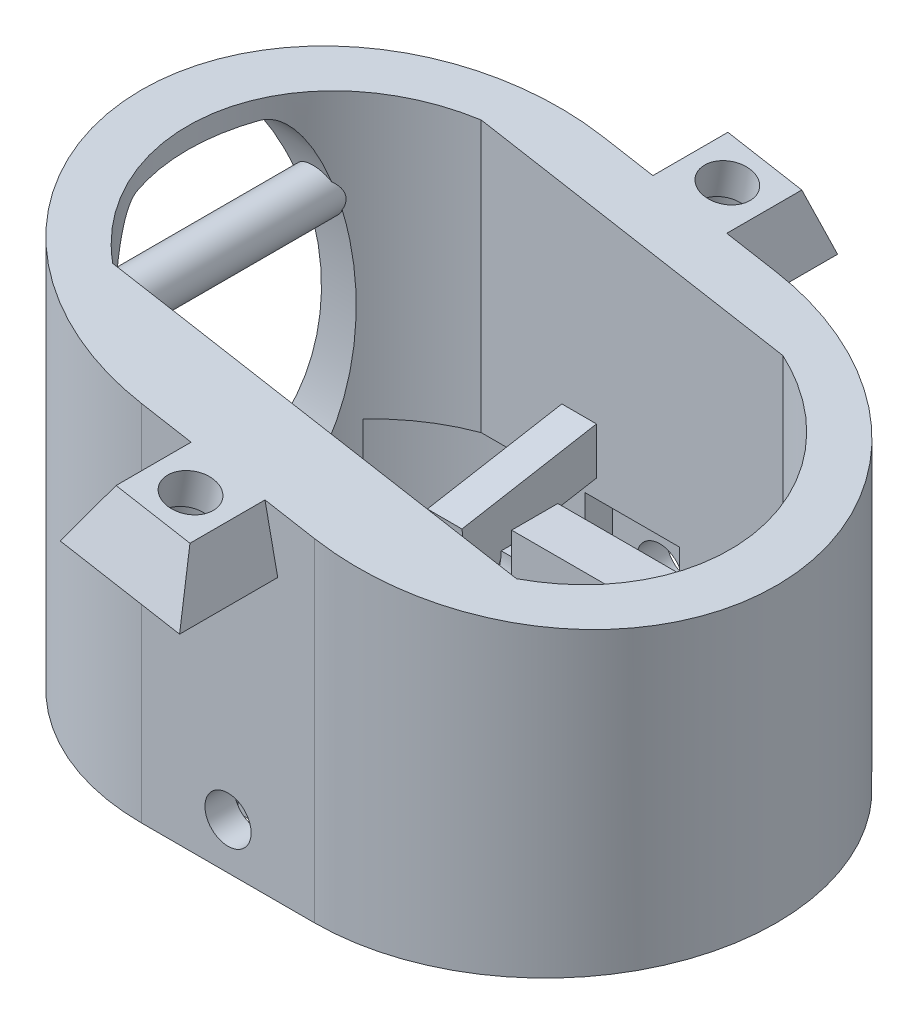
from build123d import *
from build123d.topology import SkipClean

# Parameters (mm, degrees)
BOSS_EXTRUDE1_DEPTH      = 10
BOSS_EXTRUDE1_DEPTH_BACK = 10
SKETCH1_W                = 8.2
SKETCH1_H                = 2.4
SKETCH1_R                = 1.1
BOSS_EXTRUDE2_START      = -11
BOSS_EXTRUDE2_DEPTH      = 11
CUT_EXTRUDE1_DEPTH       = 35
CUT_EXTRUDE1_DEPTH_BACK  = 25
SKETCH4_R                = 2
BOSS_EXTRUDE3_DEPTH      = 15
CUT_EXTRUDE2_DEPTH       = 20
CUT_EXTRUDE2_DEPTH_BACK  = 20
CUT_EXTRUDE3_DEPTH       = 20
CUT_EXTRUDE3_DEPTH_BACK  = 20
CUT_EXTRUDE4_DEPTH       = 40
BOSS_EXTRUDE4_DEPTH      = 10.2
BOSS_EXTRUDE4_DEPTH_BACK = 10.2
SKETCH9_R                = 2
BOSS_EXTRUDE6_DEPTH      = 2
BOSS_EXTRUDE6_DEPTH_BACK = 2
BOSS_EXTRUDE7_DEPTH      = 6.9
REVOLVE1_ANGLE           = 45
REVOLVE1_OTHER_WAY_ANGLE = 45
SKETCH15_W               = 3
SKETCH15_H               = 4.1
REVOLVE2_ANGLE           = 100
REVOLVE2_OTHER_WAY_ANGLE = 100
SKETCH16_W               = 3
SKETCH16_H               = 15
BOSS_EXTRUDE8_DEPTH      = 4
SKETCH17_W               = 3
SKETCH17_H               = 11.117878502
BOSS_EXTRUDE9_DEPTH      = 4
SKETCH20_R               = 2
CUT_EXTRUDE5_DEPTH       = 5
SKETCH22_R               = 3.25
CUT_EXTRUDE6_DEPTH       = 2


with BuildPart() as part:
    # Sketch1 → Boss-Extrude1 (new, two sides: drawn at the far end of the back side and taken through both)
    with BuildSketch(Plane(origin=(0, 0, 0), x_dir=(1, 0, 0), z_dir=(0, 1, 0)).offset(-BOSS_EXTRUDE1_DEPTH_BACK)):
        with BuildLine():
            Line((7.5, 20), (-7.5, 20))
            ThreePointArc((-7.5, 20), (-27.5, 0), (-7.5, -20))
            Line((-7.5, -20), (7.5, -20))
            ThreePointArc((7.5, -20), (27.5, 0), (7.5, 20))
        make_face()
        with Locations((0, -16.25)):
            Rectangle(SKETCH1_W, SKETCH1_H, mode=Mode.SUBTRACT)
        with Locations((22.466629547, -10)):
            Circle(SKETCH1_R, mode=Mode.SUBTRACT)
        with BuildLine():
            ThreePointArc((13.067764363, 15), (23.297278294, 2.538897101), (17.487492178, -12.5))
            Line((17.487492178, -12.5), (-15.609253973, -12.5))
            ThreePointArc((-15.609253973, -12.5), (-11.728474902, -14.287407043), (-7.5, -14.9))
            Line((-7.5, -14.9), (-7.5, -17.1))
            ThreePointArc((-7.5, -17.1), (-14.318609079, -15.681727272), (-20.006148298, -11.662171957))
            Line((-20.006148298, -11.662171957), (-19.201659226, -10.911973761))
            ThreePointArc((-19.201659226, -10.911973761), (-23.5, 0), (-19.201659226, 10.911973761))
            Line((-19.201659226, 10.911973761), (-20.006148298, 11.662171957))
            ThreePointArc((-20.006148298, 11.662171957), (-14.318609079, 15.681727272), (-7.5, 17.1))
            Line((-7.5, 17.1), (-7.5, 15))
            Line((-7.5, 15), (-4.1, 15))
            Line((-4.1, 15), (-4.1, 17.4))
            Line((-4.1, 17.4), (4.1, 17.4))
            Line((4.1, 17.4), (4.1, 15))
            Line((4.1, 15), (13.067764363, 15))
        make_face(mode=Mode.SUBTRACT)
        with Locations((22.466629547, 10)):
            Circle(SKETCH1_R, mode=Mode.SUBTRACT)
    extrude(amount=BOSS_EXTRUDE1_DEPTH + BOSS_EXTRUDE1_DEPTH_BACK)

    # Sketch3 → Boss-Extrude2 (add)
    with SkipClean():  # the faces are left unmerged after this step: merging them gives an invalid solid
        with BuildSketch(Plane(origin=(0, 10, 0), x_dir=(1, 0, 0), z_dir=(0, 1, 0)).offset(BOSS_EXTRUDE2_START)):
            with BuildLine():
                Line((-7.5, 20), (7.5, 20))
                ThreePointArc((7.5, 20), (27.5, 0), (7.5, -20))
                Line((7.5, -20), (-7.5, -20))
                ThreePointArc((-7.5, -20), (-27.5, 0), (-7.5, 20))
            make_face()
            with BuildLine():
                Line((13.067764363, 15), (-13.067764363, 15))
                ThreePointArc((-13.067764363, 15), (-23.297278294, 2.538897101), (-17.487492178, -12.5))
                Line((-17.487492178, -12.5), (17.487492178, -12.5))
                ThreePointArc((17.487492178, -12.5), (23.297278294, 2.538897101), (13.067764363, 15))
            make_face(mode=Mode.SUBTRACT)
        extrude(amount=BOSS_EXTRUDE2_DEPTH)

    # Sketch4 → Cut-Extrude1 (cut, two sides: drawn at the far end of the back side and taken through both)
    with SkipClean():  # the faces are left unmerged after this step: merging them gives an invalid solid
        with BuildSketch(Plane.XY.offset(-CUT_EXTRUDE1_DEPTH_BACK)):
            with Locations((0, -6)):
                Circle(SKETCH4_R)
        extrude(amount=CUT_EXTRUDE1_DEPTH + CUT_EXTRUDE1_DEPTH_BACK, mode=Mode.SUBTRACT)

    # Sketch5 → Boss-Extrude3 (add)
    with SkipClean():  # the faces are left unmerged after this step: merging them gives an invalid solid
        with BuildSketch(Plane(origin=(0, 10, 0), x_dir=(1, 0, 0), z_dir=(0, 1, 0))):
            with BuildLine():
                Line((-7.5, 20), (7.5, 20))
                ThreePointArc((7.5, 20), (27.5, 0), (7.5, -20))
                Line((7.5, -20), (-7.5, -20))
                ThreePointArc((-7.5, -20), (-27.5, 0), (-7.5, 20))
            make_face()
            with BuildLine():
                Line((-13.067764363, 15), (13.067764363, 15))
                ThreePointArc((13.067764363, 15), (23.297278294, 2.538897101), (17.487492178, -12.5))
                Line((17.487492178, -12.5), (-17.487492178, -12.5))
                ThreePointArc((-17.487492178, -12.5), (-23.297278294, 2.538897101), (-13.067764363, 15))
            make_face(mode=Mode.SUBTRACT)
        extrude(amount=BOSS_EXTRUDE3_DEPTH)
    add(part.part.scale(1), mode=Mode.REPLACE)  # the faces are merged on a copy

    # Sketch6 → Cut-Extrude2 (cut, two sides: drawn at the far end of the back side and taken through both)
    with BuildSketch(Plane.XY.offset(-CUT_EXTRUDE2_DEPTH_BACK)):
        Polygon((-27.5, 25), (27.5, 15.302016061), (27.5, 25), align=None)
    extrude(amount=CUT_EXTRUDE2_DEPTH + CUT_EXTRUDE2_DEPTH_BACK, mode=Mode.SUBTRACT)

    # Sketch7 → Cut-Extrude3 (cut, two sides: drawn at the far end of the back side and taken through both)
    with BuildSketch(Plane.XY.offset(-CUT_EXTRUDE3_DEPTH_BACK)):
        with BuildLine():
            Line((-27.5, 25), (-27.5, -10))
            ThreePointArc((-27.5, -10), (-27.317925824, -8.699980377), (-26.785714286, -7.5))
            ThreePointArc((-26.785714286, -7.5), (-22.5, 7.5), (-26.785714286, 22.5))
            ThreePointArc((-26.785714286, 22.5), (-27.317925824, 23.699980377), (-27.5, 25))
        make_face()
    extrude(amount=CUT_EXTRUDE3_DEPTH + CUT_EXTRUDE3_DEPTH_BACK, mode=Mode.SUBTRACT)

    # Sketch8 → Cut-Extrude4 (cut)
    with BuildSketch(Plane(origin=(0, 0, 0), x_dir=(0, 0, -1), z_dir=(1, 0, 0))):
        with BuildLine():
            Line((5.297284634, 22.5), (-5.297284634, 22.5))
            add(Edge.make_bspline(
                [(-5.297284634, 22.5), (-10.594569267, 22.5), (-10.594569267, 7.5), (-10.594569267, -7.5), (-5.297284634, -7.5)],
                knots=[0, 0, 0, 1.570796327, 1.570796327, 3.141592654, 3.141592654, 3.141592654], degree=2, weights=[1, 0.707106781, 1, 0.707106781, 1]))
            Line((-5.297284634, -7.5), (5.297284634, -7.5))
            add(Edge.make_bspline(
                [(5.297284634, -7.5), (10.594569267, -7.5), (10.594569267, 7.5), (10.594569267, 22.5), (5.297284634, 22.5)],
                knots=[3.141592654, 3.141592654, 3.141592654, 4.71238898, 4.71238898, 6.283185307, 6.283185307, 6.283185307], degree=2, weights=[1, 0.707106781, 1, 0.707106781, 1]))
        make_face()
    extrude(amount=-CUT_EXTRUDE4_DEPTH, mode=Mode.SUBTRACT)

    # Sketch9 → Boss-Extrude4 (add, two sides: drawn at the far end of the back side and taken through both)
    with BuildSketch(Plane.XY.offset(-BOSS_EXTRUDE4_DEPTH_BACK)):
        with Locations((-21.892584487, 15.541905691)):
            Circle(SKETCH9_R)
    extrude(amount=BOSS_EXTRUDE4_DEPTH + BOSS_EXTRUDE4_DEPTH_BACK)

    # Sketch11 → Boss-Extrude6 (add, two sides: drawn at the far end of the back side and taken through both)
    with BuildSketch(Plane.XY.offset(-BOSS_EXTRUDE6_DEPTH_BACK)):
        Polygon((9.566629547, 7.5), (23.566629547, 7.5), (23.566629547, 10), (6.566629547, 10), (6.566629547, -5), (23.566629547, -5), (23.566629547, -2.5), (9.566629547, -2.5), align=None)
    extrude(amount=BOSS_EXTRUDE6_DEPTH + BOSS_EXTRUDE6_DEPTH_BACK)

    # Sketch12 → Boss-Extrude7 (add)
    with BuildSketch(Plane.ZY.offset(-6.566629547)):
        with BuildLine():
            Line((-6, 2), (-4, 2))
            ThreePointArc((-4, 2), (0, -2), (4, 2))
            Line((4, 2), (6, 2))
            ThreePointArc((6, 2), (0, -4), (-6, 2))
        make_face()
    extrude(amount=BOSS_EXTRUDE7_DEPTH)

    # Sketch14 → Revolve1 (revolve)
    with BuildSketch(Plane.XY):
        Polygon((-0.533370453, -3), (-3.083370453, -3), (-3.083370453, -5.5), (-0.333370453, -5.5), (1.166629547, -4), (-0.333370453, -4), (-0.333370453, -2.8), align=None)
    revolve(axis=Axis((0.328528027, 2, 0), (-1, 0, 0)), revolution_arc=REVOLVE1_ANGLE)

    # Sketch14 → Revolve1 other way (revolve)
    with BuildSketch(Plane.XY):
        Polygon((-0.533370453, -3), (-3.083370453, -3), (-3.083370453, -5.5), (-0.333370453, -5.5), (1.166629547, -4), (-0.333370453, -4), (-0.333370453, -2.8), align=None)
    revolve(axis=Axis((0.328528027, 2, 0), (1, 0, 0)), revolution_arc=REVOLVE1_OTHER_WAY_ANGLE)

    # Sketch15 → Revolve2 (revolve)
    with BuildSketch(Plane.XY):
        with Locations((-4.583370453, -3.45)):
            Rectangle(SKETCH15_W, SKETCH15_H)
    revolve(axis=Axis((-3.715978021, 2, 0), (-1, 0, 0)), revolution_arc=REVOLVE2_ANGLE)

    # Sketch15 → Revolve2 other way (revolve)
    with BuildSketch(Plane.XY):
        with Locations((-4.583370453, -3.45)):
            Rectangle(SKETCH15_W, SKETCH15_H)
    revolve(axis=Axis((-3.715978021, 2, 0), (1, 0, 0)), revolution_arc=REVOLVE2_OTHER_WAY_ANGLE)

    # Sketch16 → Boss-Extrude8 (add)
    with BuildSketch(Plane(origin=(0, 1.939692621, 0.342020143), x_dir=(1, 0, 0), z_dir=(0, 0.9848077530122075, 0.17364817766693405))):
        with Locations((-4.583370453, 11.247296355)):
            Rectangle(SKETCH16_W, SKETCH16_H)
    extrude(amount=-BOSS_EXTRUDE8_DEPTH)

    # Sketch17 → Boss-Extrude9 (add)
    with BuildSketch(Plane(origin=(0, 1.939692621, -0.342020143), x_dir=(1, 0, 0), z_dir=(0, 0.9848077530122075, -0.17364817766693408))):
        with Locations((-4.583370453, -9.306235606)):
            Rectangle(SKETCH17_W, SKETCH17_H)
    extrude(amount=-BOSS_EXTRUDE9_DEPTH)

    # Sketch18 → Loft2 section 0
    with BuildSketch(Plane(origin=(3.446025327, 19.543380789, 0), x_dir=(0.9848077530122092, -0.17364817766692342, 0), z_dir=(0.17364817766692342, 0.9848077530122092, 0))):
        with BuildLine():
            Line((-6.749185823, 20), (-0.249185823, 20))
            Line((-0.249185823, 20), (-0.249185823, 26.5))
            Line((-0.249185823, 26.5), (-6.749185823, 26.5))
            Line((-6.749185823, 26.5), (-6.749185823, 20))
        make_face()
    # Sketch19 → Loft2 section 1
    with BuildSketch(Plane(origin=(2.577784439, 14.619342024, 0), x_dir=(-0.9848077530122092, 0.17364817766692342, 0), z_dir=(0.17364817766692342, 0.9848077530122092, 0))):
        with BuildLine():
            Line((8.749185823, -20), (-1.750814177, -20))
            Line((-1.750814177, -20), (-1.750814177, -28.5))
            Line((-1.750814177, -28.5), (8.749185823, -28.5))
            Line((8.749185823, -28.5), (8.749185823, -20))
        make_face()
    loft2 = loft()

    # Sketch20 → Cut-Extrude5 (cut)
    with BuildSketch(Plane(origin=(3.446025327, 19.543380789, 0), x_dir=(0.9848077530122092, -0.17364817766692342, 0), z_dir=(0.17364817766692342, 0.9848077530122092, 0))):
        with Locations((-3.499185823, 23.25)):
            Circle(SKETCH20_R)
    cut_extrude5 = extrude(amount=-CUT_EXTRUDE5_DEPTH, mode=Mode.SUBTRACT)

    # Sketch22 → Cut-Extrude6 (cut)
    with BuildSketch(Plane(origin=(2.577784439, 14.619342024, 0), x_dir=(0.9848077530122094, -0.17364817766692336, 0), z_dir=(-0.17364817766692334, -0.9848077530122092, 0))):
        with Locations((-3.499185823, -23.25)):
            Circle(SKETCH22_R)
    cut_extrude6 = extrude(amount=-CUT_EXTRUDE6_DEPTH, mode=Mode.SUBTRACT)

    # Mirror1: Loft2, Cut-Extrude5, Cut-Extrude6 across plane
    add(loft2.mirror(Plane.XY))
    add(cut_extrude5.mirror(Plane.XY), mode=Mode.SUBTRACT)
    add(cut_extrude6.mirror(Plane.XY), mode=Mode.SUBTRACT)


solid = part.part
